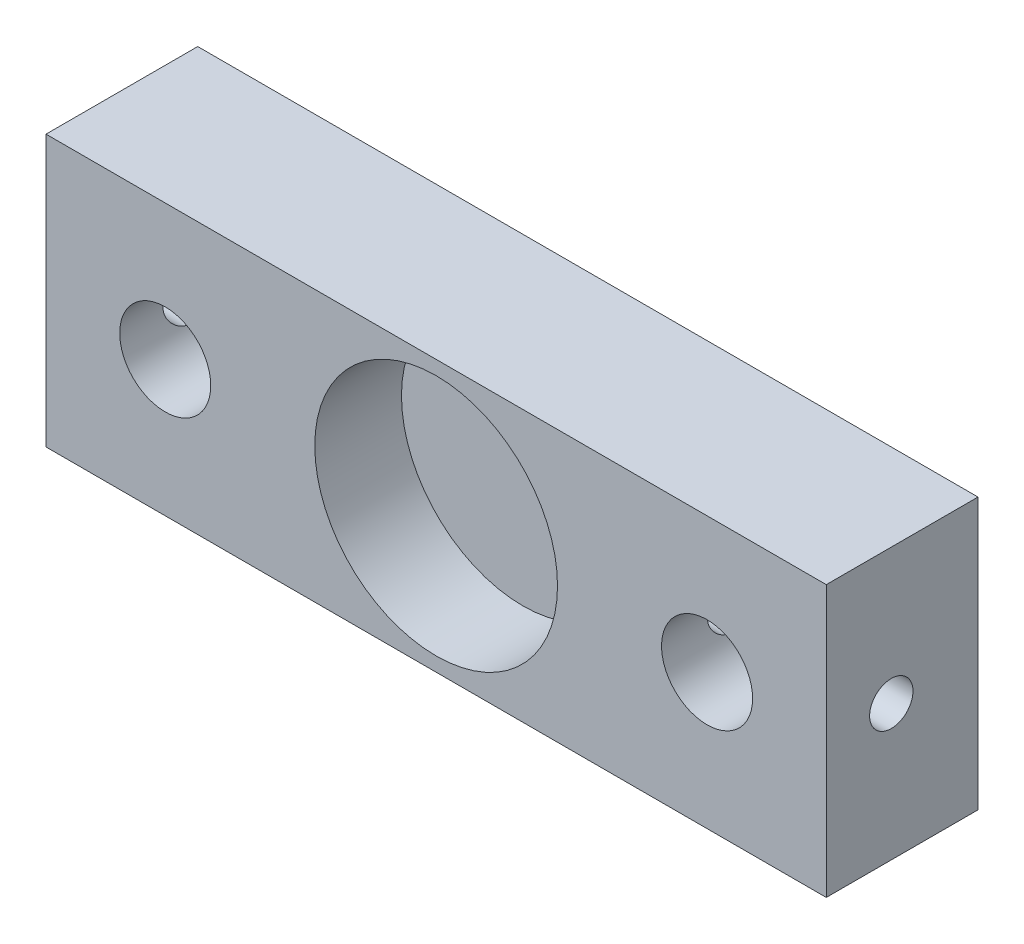
from build123d import *

# Parameters (mm, degrees)
SKETCH1_W           = 72
SKETCH1_H           = 25
BOSS_EXTRUDE1_DEPTH = 14
SKETCH2_R           = 11.2
CUT_EXTRUDE1_DEPTH  = 8
SKETCH3_R           = 4.2
CUT_EXTRUDE2_DEPTH  = 12
CUT_EXTRUDE3_REACH  = 76.406
SKETCH6_R           = 2


with BuildPart() as part:
    # Sketch1 → Boss-Extrude1 (new body)
    with BuildSketch(Plane.XY):
        Rectangle(SKETCH1_W, SKETCH1_H)
    extrude(amount=BOSS_EXTRUDE1_DEPTH)

    # Sketch2 → Cut-Extrude1 (cut)
    with BuildSketch(Plane.XY.offset(14)):
        Circle(SKETCH2_R)
    extrude(amount=-CUT_EXTRUDE1_DEPTH, mode=Mode.SUBTRACT)

    # Sketch3 → Cut-Extrude2 (cut)
    with BuildSketch(Plane.XY.offset(14)):
        with Locations((-25, 0)):
            Circle(SKETCH3_R)
        with Locations((25, 0)):
            Circle(SKETCH3_R)
    extrude(amount=-CUT_EXTRUDE2_DEPTH, mode=Mode.SUBTRACT)

    # Sketch5 → Ø3.5 (3.5) Diameter Hole1 (revolve, cut)
    with BuildSketch(Plane(origin=(-36, 0, 8), x_dir=(0, 0, 1), z_dir=(0, 1, 0))):
        Polygon((0, 0), (0, 21.051506083), (1.75, 20), (1.75, 0), align=None)
    f_3_5_3_5_diameter_hole1 = revolve(axis=Axis((-42.35, 0, 8), (1, 0, 0)), mode=Mode.SUBTRACT)

    # Sketch6 → Cut-Extrude3 (cut, up to next)
    with BuildSketch(Plane.ZY.offset(36), mode=Mode.PRIVATE) as cut_extrude3_sk1:
        with Locations((8, 0)):
            Circle(SKETCH6_R)
    cut_extrude3_tool1 = extrude(cut_extrude3_sk1.sketch, amount=-CUT_EXTRUDE3_REACH, mode=Mode.PRIVATE) & part.part
    cut_extrude3 = cut_extrude3_tool1.solids().sort_by_distance((-36, 0, 8))[0]
    add(cut_extrude3, mode=Mode.SUBTRACT)

    # Mirror1: Ø3.5 (3.5) Diameter Hole1, Cut-Extrude3 across plane
    add(f_3_5_3_5_diameter_hole1.mirror(Plane(origin=(0, 0, 0), x_dir=(0, 0, 1), z_dir=(1, 0, 0))), mode=Mode.SUBTRACT)
    add(cut_extrude3.mirror(Plane(origin=(0, 0, 0), x_dir=(0, 0, 1), z_dir=(1, 0, 0))), mode=Mode.SUBTRACT)


solid = part.part
